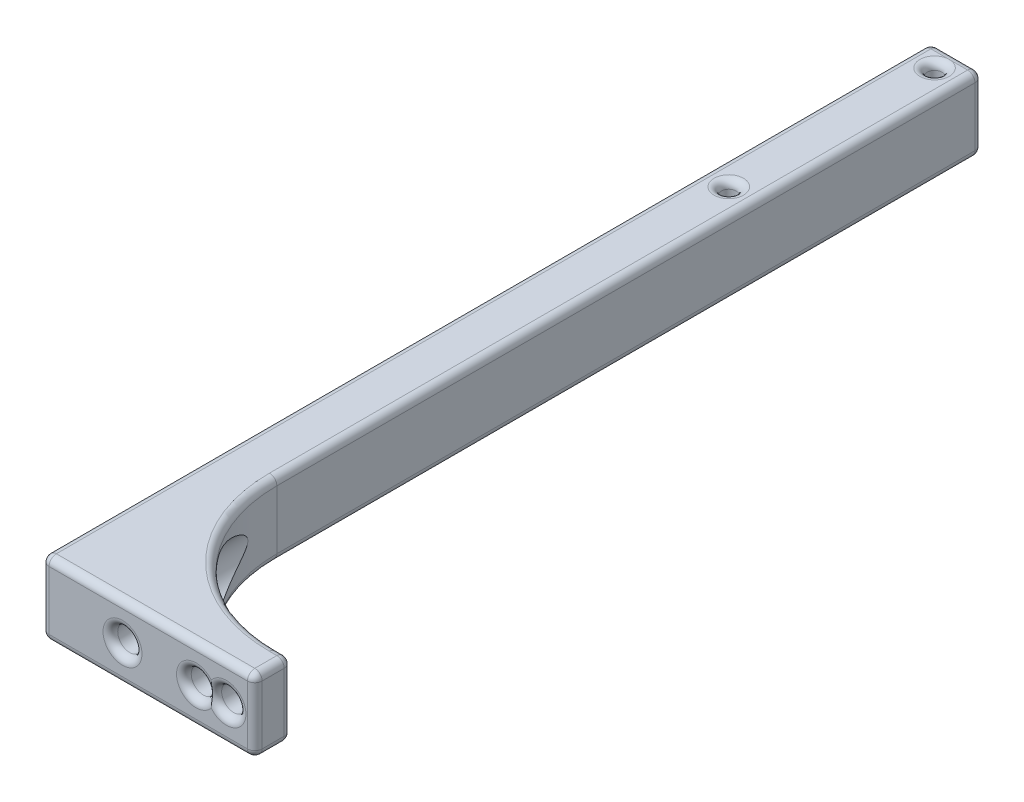
from build123d import *

# Parameters (mm, degrees)
SKETCH1_W                = 7
SKETCH1_H                = 121
SKETCH1_R                = 1
BOSS_EXTRUDE1_DEPTH      = 10
BOSS_EXTRUDE2_DEPTH      = 22
BOSS_EXTRUDE2_DEPTH_BACK = 7
SKETCH2_W                = 5
SKETCH2_H                = 10
SKETCH3_R                = 1.65
CUT_EXTRUDE1_DEPTH       = 20
FILLET1_R                = 20
FILLET2_R                = 1
SKETCH6_R                = 3.5
CUT_EXTRUDE3_DEPTH       = 120.987499349


with BuildPart() as part:
    # Sketch1 → Boss-Extrude1 (new body)
    with BuildSketch(Plane(origin=(0, 0, 0), x_dir=(1, 0, 0), z_dir=(0, 1, 0))):
        with Locations((3.5, 60.5)):
            Rectangle(SKETCH1_W, SKETCH1_H)
        with Locations(Location((3.5, 118, 0), (0, 0, 270))):
            Circle(SKETCH1_R, mode=Mode.SUBTRACT)
        with Locations(Location((3.5, 90, 0), (0, 0, 270))):
            Circle(SKETCH1_R, mode=Mode.SUBTRACT)
    extrude(amount=BOSS_EXTRUDE1_DEPTH)

    # Sketch2 → Boss-Extrude2 (add, two sides: drawn at the far end of the back side and taken through both)
    with BuildSketch(Plane(origin=(7, 0, 0), x_dir=(0, 0, -1), z_dir=(1, 0, 0)).offset(-BOSS_EXTRUDE2_DEPTH_BACK)):
        with Locations((2.5, 5)):
            Rectangle(SKETCH2_W, SKETCH2_H)
    extrude(amount=BOSS_EXTRUDE2_DEPTH + BOSS_EXTRUDE2_DEPTH_BACK)

    # Sketch3 → Cut-Extrude1 (cut)
    with BuildSketch(Plane(origin=(0, 0, -5), x_dir=(-1, 0, 0), z_dir=(0, 0, -1))):
        with Locations((-21, 5)):
            Circle(SKETCH3_R)
        with Locations((-11, 5)):
            Circle(SKETCH3_R)
        with Locations((-25.14, 5)):
            Circle(SKETCH3_R)
    extrude(amount=-CUT_EXTRUDE1_DEPTH, mode=Mode.SUBTRACT)

    # Fillet1
    # the kernel refuses this fillet: 20 mm, written as the material it adds along each edge
    with BuildSketch(Plane(origin=(7, 10, -5), x_dir=(1, 0, 0), z_dir=(0, -1, 0))) as fillet1_piece_1_section:
        with BuildLine():
            CenterArc((FILLET1_R, -FILLET1_R), FILLET1_R, 90, 90)
            Line((0, -FILLET1_R), (0, 0))
            Line((0, 0), (FILLET1_R, 0))
        make_face()
    fillet1_piece_1 = extrude(amount=10, mode=Mode.PRIVATE)
    fillet1_piece_1 = fillet1_piece_1 - Plane(origin=(11, 5, -10.788801803), x_dir=(-1, 0, 0), z_dir=(0, 0, -1)) * Cylinder(1.65, 100, mode=Mode.PRIVATE)
    fillet1_piece_1 = fillet1_piece_1 - Plane(origin=(21, 5, -10.788801803), x_dir=(-1, 0, 0), z_dir=(0, 0, -1)) * Cylinder(1.65, 100, mode=Mode.PRIVATE)
    fillet1_piece_1 = fillet1_piece_1 - Plane(origin=(25.14, 5, -10.788801803), x_dir=(-1, 0, 0), z_dir=(0, 0, -1)) * Cylinder(1.65, 100, mode=Mode.PRIVATE)
    add(fillet1_piece_1)

    # Fillet2
    # the kernel refuses this fillet: 1 mm, written as the material it takes off along each edge
    with BuildSketch(Plane(origin=(6, 9, -120), x_dir=(0, 1, 0), z_dir=(1, 0, 0))) as fillet2_piece_1_section:
        Polygon((0, 0), (FILLET2_R, 0), (FILLET2_R, -FILLET2_R), (0, -FILLET2_R), align=None)
    fillet2_piece_1 = extrude(amount=FILLET2_R, mode=Mode.PRIVATE)
    fillet2_piece_1 = fillet2_piece_1 - Plane(origin=(6, 9, -120), x_dir=(0, -0.7071067811865475, 0.7071067811865475), z_dir=(1, 0, 0)) * Sphere(FILLET2_R, mode=Mode.PRIVATE)
    add(fillet2_piece_1, mode=Mode.SUBTRACT)
    with BuildSketch(Plane(origin=(1, 9, -120), x_dir=(0, 1, 0), z_dir=(-1, 0, 0))) as fillet2_piece_2_section:
        Polygon((0, 0), (FILLET2_R, 0), (FILLET2_R, FILLET2_R), (0, FILLET2_R), align=None)
    fillet2_piece_2 = extrude(amount=FILLET2_R, mode=Mode.PRIVATE)
    fillet2_piece_2 = fillet2_piece_2 - Plane(origin=(1, 9, -120), x_dir=(0, -0.7071067811865475, 0.7071067811865475), z_dir=(-1, 0, 0)) * Sphere(FILLET2_R, mode=Mode.PRIVATE)
    add(fillet2_piece_2, mode=Mode.SUBTRACT)
    with BuildSketch(Plane(origin=(28, 1, -1), x_dir=(0, 0, 1), z_dir=(0, -1, 0))) as fillet2_piece_3_section:
        Polygon((0, 0), (FILLET2_R, 0), (FILLET2_R, -FILLET2_R), (0, -FILLET2_R), align=None)
    fillet2_piece_3 = extrude(amount=FILLET2_R, mode=Mode.PRIVATE)
    fillet2_piece_3 = fillet2_piece_3 - Plane(origin=(28, 1, -1), x_dir=(-0.7071067811865475, 0, -0.7071067811865476), z_dir=(0, -1, 0)) * Sphere(FILLET2_R, mode=Mode.PRIVATE)
    add(fillet2_piece_3, mode=Mode.SUBTRACT)
    with BuildSketch(Plane(origin=(28, 9, -1), x_dir=(1, 0, 0), z_dir=(0, 0, 1))) as fillet2_piece_4_section:
        Polygon((0, 0), (FILLET2_R, 0), (FILLET2_R, FILLET2_R), (0, FILLET2_R), align=None)
    fillet2_piece_4 = extrude(amount=FILLET2_R, mode=Mode.PRIVATE)
    fillet2_piece_4 = fillet2_piece_4 - Plane(origin=(28, 9, -1), x_dir=(-0.7071067811865475, -0.7071067811865475, 0), z_dir=(0, 0, 1)) * Sphere(FILLET2_R, mode=Mode.PRIVATE)
    add(fillet2_piece_4, mode=Mode.SUBTRACT)
    with BuildSketch(Plane(origin=(28, 1, -4), x_dir=(1, 0, 0), z_dir=(0, -1, 0))) as fillet2_piece_5_section:
        Polygon((0, 0), (FILLET2_R, 0), (FILLET2_R, -FILLET2_R), (0, -FILLET2_R), align=None)
    fillet2_piece_5 = extrude(amount=FILLET2_R, mode=Mode.PRIVATE)
    fillet2_piece_5 = fillet2_piece_5 - Plane(origin=(28, 1, -4), x_dir=(-0.7071067811865475, 0, 0.7071067811865475), z_dir=(0, -1, 0)) * Sphere(FILLET2_R, mode=Mode.PRIVATE)
    add(fillet2_piece_5, mode=Mode.SUBTRACT)
    with BuildSketch(Plane(origin=(28, 9, -4), x_dir=(0, 1, 0), z_dir=(1, 0, 0))) as fillet2_piece_6_section:
        Polygon((0, 0), (FILLET2_R, 0), (FILLET2_R, -FILLET2_R), (0, -FILLET2_R), align=None)
    fillet2_piece_6 = extrude(amount=FILLET2_R, mode=Mode.PRIVATE)
    fillet2_piece_6 = fillet2_piece_6 - Plane(origin=(28, 9, -4), x_dir=(0, -0.7071067811865477, 0.7071067811865475), z_dir=(1, 0, 0)) * Sphere(FILLET2_R, mode=Mode.PRIVATE)
    add(fillet2_piece_6, mode=Mode.SUBTRACT)
    with BuildSketch(Plane(origin=(1, 9, -1), x_dir=(-1, 0, 0), z_dir=(0, 0, 1))) as fillet2_piece_7_section:
        Polygon((0, 0), (FILLET2_R, 0), (FILLET2_R, -FILLET2_R), (0, -FILLET2_R), align=None)
    fillet2_piece_7 = extrude(amount=FILLET2_R, mode=Mode.PRIVATE)
    fillet2_piece_7 = fillet2_piece_7 - Plane(origin=(1, 9, -1), x_dir=(0.7071067811865475, -0.7071067811865475, 0), z_dir=(0, 0, 1)) * Sphere(FILLET2_R, mode=Mode.PRIVATE)
    add(fillet2_piece_7, mode=Mode.SUBTRACT)
    with BuildSketch(Plane(origin=(6, 1, -120), x_dir=(0, -1, 0), z_dir=(1, 0, 0))) as fillet2_piece_8_section:
        Polygon((0, 0), (FILLET2_R, 0), (FILLET2_R, FILLET2_R), (0, FILLET2_R), align=None)
    fillet2_piece_8 = extrude(amount=FILLET2_R, mode=Mode.PRIVATE)
    fillet2_piece_8 = fillet2_piece_8 - Plane(origin=(6, 1, -120), x_dir=(0, 0.7071067811865475, 0.7071067811865475), z_dir=(1, 0, 0)) * Sphere(FILLET2_R, mode=Mode.PRIVATE)
    add(fillet2_piece_8, mode=Mode.SUBTRACT)
    with BuildSketch(Plane(origin=(1, 1, -120), x_dir=(-1, 0, 0), z_dir=(0, -1, 0))) as fillet2_piece_9_section:
        Polygon((0, 0), (FILLET2_R, 0), (FILLET2_R, FILLET2_R), (0, FILLET2_R), align=None)
    fillet2_piece_9 = extrude(amount=FILLET2_R, mode=Mode.PRIVATE)
    fillet2_piece_9 = fillet2_piece_9 - Plane(origin=(1, 1, -120), x_dir=(0.7071067811865475, 0, 0.7071067811865475), z_dir=(0, -1, 0)) * Sphere(FILLET2_R, mode=Mode.PRIVATE)
    add(fillet2_piece_9, mode=Mode.SUBTRACT)
    with BuildSketch(Plane(origin=(1, 1, -1), x_dir=(0, 0, 1), z_dir=(0, -1, 0))) as fillet2_piece_10_section:
        Polygon((0, 0), (FILLET2_R, 0), (FILLET2_R, FILLET2_R), (0, FILLET2_R), align=None)
    fillet2_piece_10 = extrude(amount=FILLET2_R, mode=Mode.PRIVATE)
    fillet2_piece_10 = fillet2_piece_10 - Plane(origin=(1, 1, -1), x_dir=(0.7071067811865475, 0, -0.7071067811865475), z_dir=(0, -1, 0)) * Sphere(FILLET2_R, mode=Mode.PRIVATE)
    add(fillet2_piece_10, mode=Mode.SUBTRACT)
    with BuildSketch(Plane(origin=(3.5, 0, -118), x_dir=(0, 0, 1), z_dir=(-1, 0, 0))) as fillet2_piece_11:
        with BuildLine():
            CenterArc((1 + FILLET2_R, FILLET2_R), FILLET2_R, 180, 90)
            Line((1, FILLET2_R), (1, 0))
            Line((1, 0), (1 + FILLET2_R, 0))
        make_face()
    revolve(axis=Axis((3.5, 0, -118), (0, 1, 0)), mode=Mode.SUBTRACT)
    with BuildSketch(Plane(origin=(3.5, 10, -118), x_dir=(0, 0, 1), z_dir=(-1, 0, 0))) as fillet2_piece_12:
        with BuildLine():
            CenterArc((1 + FILLET2_R, -FILLET2_R), FILLET2_R, 90, 90)
            Line((1 + FILLET2_R, 0), (1, 0))
            Line((1, 0), (1, -FILLET2_R))
        make_face()
    revolve(axis=Axis((3.5, 10, -118), (0, 1, 0)), mode=Mode.SUBTRACT)
    with BuildSketch(Plane(origin=(3.5, 0, -90), x_dir=(0, 0, 1), z_dir=(-1, 0, 0))) as fillet2_piece_13:
        with BuildLine():
            CenterArc((1 + FILLET2_R, FILLET2_R), FILLET2_R, 180, 90)
            Line((1, FILLET2_R), (1, 0))
            Line((1, 0), (1 + FILLET2_R, 0))
        make_face()
    revolve(axis=Axis((3.5, 0, -90), (0, 1, 0)), mode=Mode.SUBTRACT)
    with BuildSketch(Plane(origin=(3.5, 10, -90), x_dir=(0, 0, 1), z_dir=(-1, 0, 0))) as fillet2_piece_14:
        with BuildLine():
            CenterArc((1 + FILLET2_R, -FILLET2_R), FILLET2_R, 90, 90)
            Line((1 + FILLET2_R, 0), (1, 0))
            Line((1, 0), (1, -FILLET2_R))
        make_face()
    revolve(axis=Axis((3.5, 10, -90), (0, 1, 0)), mode=Mode.SUBTRACT)
    with BuildSketch(Plane(origin=(6, 10, -121), x_dir=(0, -1, 0), z_dir=(-1, 0, 0))) as fillet2_piece_15:
        with BuildLine():
            CenterArc((FILLET2_R, FILLET2_R), FILLET2_R, 180, 90)
            Line((0, FILLET2_R), (0, 0))
            Line((0, 0), (FILLET2_R, 0))
        make_face()
    extrude(amount=5, mode=Mode.SUBTRACT)
    with BuildSketch(Plane(origin=(29, 1, 0), x_dir=(-1, 0, 0), z_dir=(0, 1, 0))) as fillet2_piece_16:
        with BuildLine():
            CenterArc((FILLET2_R, -FILLET2_R), FILLET2_R, 90, 90)
            Line((0, -FILLET2_R), (0, 0))
            Line((0, 0), (FILLET2_R, 0))
        make_face()
    extrude(amount=8, mode=Mode.SUBTRACT)
    with BuildSketch(Plane(origin=(29, 0, -4), x_dir=(0, 1, 0), z_dir=(0, 0, 1)), Plane(origin=(29, 10, -1), x_dir=(0, -1, 0), z_dir=(0, 0, -1))) as fillet2_piece_17:
        with BuildLine():
            CenterArc((FILLET2_R, FILLET2_R), FILLET2_R, 180, 90)
            Line((0, FILLET2_R), (0, 0))
            Line((0, 0), (FILLET2_R, 0))
        make_face()
    extrude(amount=3, mode=Mode.SUBTRACT)
    with BuildSketch(Plane(origin=(29, 9, -5), x_dir=(0, 0, 1), z_dir=(0, -1, 0)), Plane(origin=(0, 1, -121), x_dir=(0, 0, 1), z_dir=(0, 1, 0)), Plane(origin=(7, 1, -121), x_dir=(-1, 0, 0), z_dir=(0, 1, 0)), Plane(origin=(0, 1, 0), x_dir=(1, 0, 0), z_dir=(0, 1, 0))) as fillet2_piece_18:
        with BuildLine():
            CenterArc((FILLET2_R, FILLET2_R), FILLET2_R, 180, 90)
            Line((0, FILLET2_R), (0, 0))
            Line((0, 0), (FILLET2_R, 0))
        make_face()
    extrude(amount=8, mode=Mode.SUBTRACT)
    with BuildSketch(Plane(origin=(25.14, 5, 0), x_dir=(-1, 0, 0), z_dir=(0, -1, 0))) as fillet2_piece_19:
        with BuildLine():
            CenterArc((1.65 + FILLET2_R, FILLET2_R), FILLET2_R, 180, 90)
            Line((1.65 + FILLET2_R, 0), (1.65, 0))
            Line((1.65, 0), (1.65, FILLET2_R))
        make_face()
    revolve(axis=Axis((25.14, 5, 0), (0, 0, -1)), mode=Mode.SUBTRACT)
    with BuildSketch(Plane(origin=(0, 10, -1), x_dir=(0, -1, 0), z_dir=(0, 0, -1)), Plane(origin=(0, 0, -120), x_dir=(0, 1, 0), z_dir=(0, 0, 1))) as fillet2_piece_20:
        with BuildLine():
            CenterArc((FILLET2_R, -FILLET2_R), FILLET2_R, 90, 90)
            Line((0, -FILLET2_R), (0, 0))
            Line((0, 0), (FILLET2_R, 0))
        make_face()
    extrude(amount=119, mode=Mode.SUBTRACT)
    with BuildSketch(Plane(origin=(6, 0, -121), x_dir=(0, 1, 0), z_dir=(-1, 0, 0))) as fillet2_piece_21:
        with BuildLine():
            CenterArc((FILLET2_R, -FILLET2_R), FILLET2_R, 90, 90)
            Line((0, -FILLET2_R), (0, 0))
            Line((0, 0), (FILLET2_R, 0))
        make_face()
    extrude(amount=5, mode=Mode.SUBTRACT)
    with BuildSketch(Plane(origin=(11, 5, 0), x_dir=(-1, 0, 0), z_dir=(0, -1, 0))) as fillet2_piece_22:
        with BuildLine():
            CenterArc((1.65 + FILLET2_R, FILLET2_R), FILLET2_R, 180, 90)
            Line((1.65, FILLET2_R), (1.65, 0))
            Line((1.65, 0), (1.65 + FILLET2_R, 0))
        make_face()
    revolve(axis=Axis((11, 5, 0), (0, 0, -1)), mode=Mode.SUBTRACT)
    with BuildSketch(Plane(origin=(21, 5, 0), x_dir=(-1, 0, 0), z_dir=(0, -1, 0))) as fillet2_piece_23:
        with BuildLine():
            CenterArc((1.65 + FILLET2_R, FILLET2_R), FILLET2_R, 180, 90)
            Line((1.65, FILLET2_R), (1.65, 0))
            Line((1.65, 0), (1.65 + FILLET2_R, 0))
        make_face()
    revolve(axis=Axis((21, 5, 0), (0, 0, -1)), mode=Mode.SUBTRACT)
    with BuildSketch(Plane(origin=(1, 0, 0), x_dir=(0, 1, 0), z_dir=(1, 0, 0)), Plane(origin=(28, 10, 0), x_dir=(0, -1, 0), z_dir=(-1, 0, 0))) as fillet2_piece_24:
        with BuildLine():
            CenterArc((FILLET2_R, -FILLET2_R), FILLET2_R, 90, 90)
            Line((0, -FILLET2_R), (0, 0))
            Line((0, 0), (FILLET2_R, 0))
        make_face()
    extrude(amount=27, mode=Mode.SUBTRACT)
    with BuildSketch(Plane(origin=(7, 10, -25), x_dir=(0, -1, 0), z_dir=(0, 0, -1))) as fillet2_piece_25:
        with BuildLine():
            CenterArc((FILLET2_R, FILLET2_R), FILLET2_R, 180, 90)
            Line((0, FILLET2_R), (0, 0))
            Line((0, 0), (FILLET2_R, 0))
        make_face()
    extrude(amount=95, mode=Mode.SUBTRACT)
    with BuildSketch(Plane(origin=(7, 0, -25), x_dir=(0, 1, 0), z_dir=(0, 0, -1))) as fillet2_piece_26:
        with BuildLine():
            CenterArc((FILLET2_R, -FILLET2_R), FILLET2_R, 90, 90)
            Line((0, -FILLET2_R), (0, 0))
            Line((0, 0), (FILLET2_R, 0))
        make_face()
    extrude(amount=95, mode=Mode.SUBTRACT)
    with BuildSketch(Plane(origin=(28, 10, -5), x_dir=(0, 0, 1), z_dir=(-1, 0, 0))) as fillet2_piece_27:
        with BuildLine():
            CenterArc((FILLET2_R, -FILLET2_R), FILLET2_R, 90, 90)
            Line((0, -FILLET2_R), (0, 0))
            Line((0, 0), (FILLET2_R, 0))
        make_face()
    extrude(amount=1, mode=Mode.SUBTRACT)
    with BuildSketch(Plane(origin=(28, 0, -5), x_dir=(0, 0, 1), z_dir=(-1, 0, 0))) as fillet2_piece_28:
        with BuildLine():
            CenterArc((FILLET2_R, FILLET2_R), FILLET2_R, 180, 90)
            Line((0, FILLET2_R), (0, 0))
            Line((0, 0), (FILLET2_R, 0))
        make_face()
    extrude(amount=1, mode=Mode.SUBTRACT)
    with BuildSketch(Plane(origin=(27, 0, -25), x_dir=(0, 0, 1), z_dir=(1, 0, 0))) as fillet2_piece_29:
        with BuildLine():
            CenterArc((20 + FILLET2_R, -FILLET2_R), FILLET2_R, 90, 90)
            Line((20 + FILLET2_R, 0), (20, 0))
            Line((20, 0), (20, -FILLET2_R))
        make_face()
    revolve(axis=Axis((27, 0, -25), (0, -1, 0)), revolution_arc=90, mode=Mode.SUBTRACT)
    with BuildSketch(Plane(origin=(27, 10, -25), x_dir=(0, 0, 1), z_dir=(1, 0, 0))) as fillet2_piece_30:
        with BuildLine():
            CenterArc((20 + FILLET2_R, FILLET2_R), FILLET2_R, 180, 90)
            Line((20 + FILLET2_R, 0), (20, 0))
            Line((20, 0), (20, FILLET2_R))
        make_face()
    revolve(axis=Axis((27, 10, -25), (0, -1, 0)), revolution_arc=90, mode=Mode.SUBTRACT)

    # Sketch6 → Cut-Extrude3 (cut, through all)
    with BuildSketch(Plane.XY.offset(-5)):
        with Locations((11, 5)):
            Circle(SKETCH6_R)
        with BuildLine():
            ThreePointArc((23.07, 7.822250875), (17.5, 5), (23.07, 2.177749125))
            ThreePointArc((23.07, 2.177749125), (28.64, 5), (23.07, 7.822250875))
        make_face()
    extrude(amount=-CUT_EXTRUDE3_DEPTH, mode=Mode.SUBTRACT)


solid = part.part
